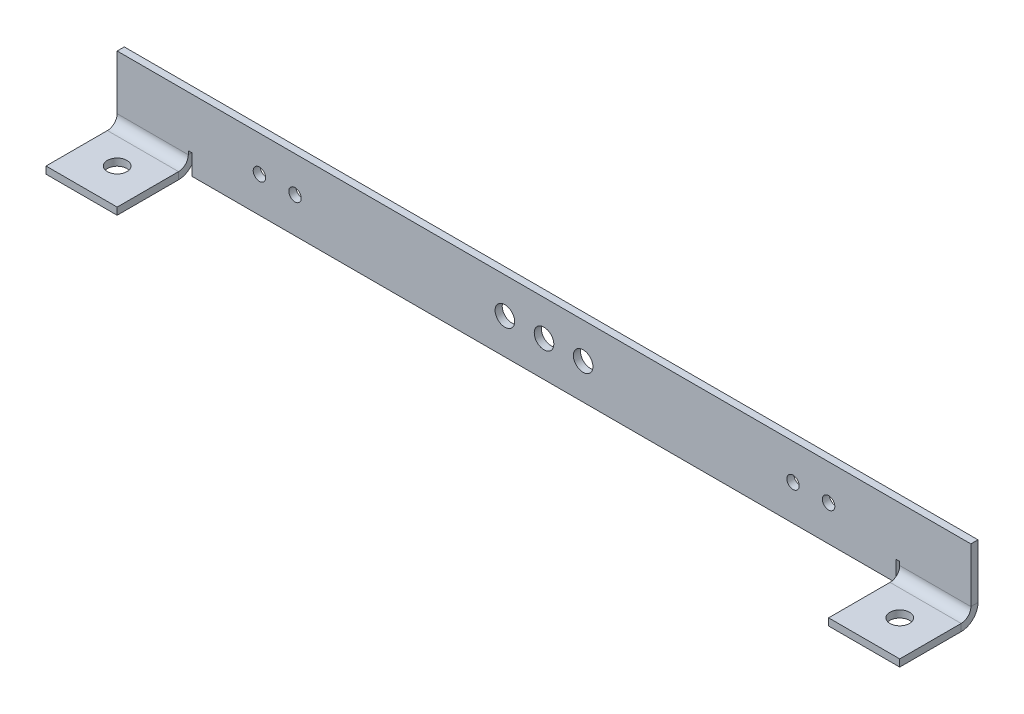
from build123d import *

# Parameters (mm, degrees)
SKETCH_1_W                        = 240
SKETCH_1_H                        = 20
SM_BASE_FLANGE_1_DEPTH            = 2
SM_EDGE_FLANGE_1_STRIP_W          = 13.4732
SM_EDGE_FLANGE_1_STRIP_H          = 2
SM_EDGE_FLANGE_1_STRIP_CUT_DEPTH  = 20
SM_EDGE_FLANGE_1_RELIEF_W         = 14.4732
SM_EDGE_FLANGE_1_RELIEF_H         = 1
SM_EDGE_FLANGE_1_RELIEF_CUT_DEPTH = 2
SM_EDGE_FLANGE_1_DEPTH            = 20
SKETCH_10_R                       = 2.75
CUT_EXTRUDE_2_DEPTH               = 10
SKETCH_11_R                       = 2.75
SKETCH_11_R_2                     = 1.75
CUT_EXTRUDE_3_DEPTH               = 10


# Sheet-metal steps are written as plain solids
with BuildPart() as part:
    # Sketch 1 → 基体-法兰1 (new body)
    with BuildSketch(Plane.XY):
        with Locations((0, -10)):
            Rectangle(SKETCH_1_W, SKETCH_1_H)
    extrude(amount=-SM_BASE_FLANGE_1_DEPTH)

    # 边线-法兰1 strip (across the edge) → 边线-法兰1 strip cut (cut)
    with BuildSketch(Plane(origin=(-120, -20, 0), x_dir=(0, 1, 0), z_dir=(1, 0, 0))):
        with Locations((-2, -1)):
            Rectangle(SM_EDGE_FLANGE_1_STRIP_W, SM_EDGE_FLANGE_1_STRIP_H)
    sm_edge_flange_1_strip_cut = extrude(amount=SM_EDGE_FLANGE_1_STRIP_CUT_DEPTH, mode=Mode.SUBTRACT)

    # 边线-法兰1 relief (on the sheet) → 边线-法兰1 relief cut (cut)
    with BuildSketch(Plane(origin=(-120, -15.2634, 0), x_dir=(0, 1, 0), z_dir=(0, 0, 1))):
        with Locations((-6.2366, -20.5)):
            Rectangle(SM_EDGE_FLANGE_1_RELIEF_W, SM_EDGE_FLANGE_1_RELIEF_H)
    sm_edge_flange_1_relief_cut = extrude(amount=-SM_EDGE_FLANGE_1_RELIEF_CUT_DEPTH, mode=Mode.SUBTRACT)

    # 边线-法兰1 section (across the edge) → 边线-法兰1 (add)
    with BuildSketch(Plane(origin=(-120, -20, 0), x_dir=(0, 1, 0), z_dir=(1, 0, 0))):
        with BuildLine():
            Line((0, 2.7366), (0, 20))
            Line((0, 20), (2, 20))
            Line((2, 20), (2, 2.7366))
            ThreePointArc((2, 2.7366), (2.801531583, 0.801531583), (4.7366, 0))
            Line((4.7366, 0), (4.7366, -2))
            ThreePointArc((4.7366, -2), (1.38731802, -0.61268198), (0, 2.7366))
        make_face()
    sm_edge_flange_1 = extrude(amount=SM_EDGE_FLANGE_1_DEPTH)

    # 草图10 → 切除-拉伸2 (cut)
    with BuildSketch(Plane(origin=(0, -18, 0), x_dir=(1, 0, 0), z_dir=(0, 1, 0))):
        with Locations(Location((-110, -10, 0), (0, 0, 270))):
            Circle(SKETCH_10_R)
    cut_extrude_2 = extrude(amount=-CUT_EXTRUDE_2_DEPTH, mode=Mode.SUBTRACT)

    # 镜向1: 边线-法兰1 strip cut, 边线-法兰1 relief cut, 边线-法兰1, 切除-拉伸2 across plane
    add(sm_edge_flange_1_strip_cut.mirror(Plane(origin=(0, 0, 0), x_dir=(0, 0, 1), z_dir=(1, 0, 0))), mode=Mode.SUBTRACT)
    add(sm_edge_flange_1_relief_cut.mirror(Plane(origin=(0, 0, 0), x_dir=(0, 0, 1), z_dir=(1, 0, 0))), mode=Mode.SUBTRACT)
    add(sm_edge_flange_1.mirror(Plane(origin=(0, 0, 0), x_dir=(0, 0, 1), z_dir=(1, 0, 0))))
    add(cut_extrude_2.mirror(Plane(origin=(0, 0, 0), x_dir=(0, 0, 1), z_dir=(1, 0, 0))), mode=Mode.SUBTRACT)

    # 草图11 → 切除-拉伸3 (cut)
    with BuildSketch(Plane(origin=(0, 0, -2), x_dir=(-1, 0, 0), z_dir=(0, 0, -1))):
        with Locations((0, -10)):
            Circle(SKETCH_11_R)
        with Locations((-11, -10)):
            Circle(SKETCH_11_R)
        with Locations(Location((11, -10, 0), (0, 0, 180))):
            Circle(SKETCH_11_R)
        with Locations((-80, -10)):
            Circle(SKETCH_11_R_2)
        with Locations((-70, -10)):
            Circle(SKETCH_11_R_2)
        with Locations(Location((80, -10, 0), (0, 0, 180))):
            Circle(SKETCH_11_R_2)
        with Locations(Location((70, -10, 0), (0, 0, 180))):
            Circle(SKETCH_11_R_2)
    extrude(amount=-CUT_EXTRUDE_3_DEPTH, mode=Mode.SUBTRACT)


solid = part.part
